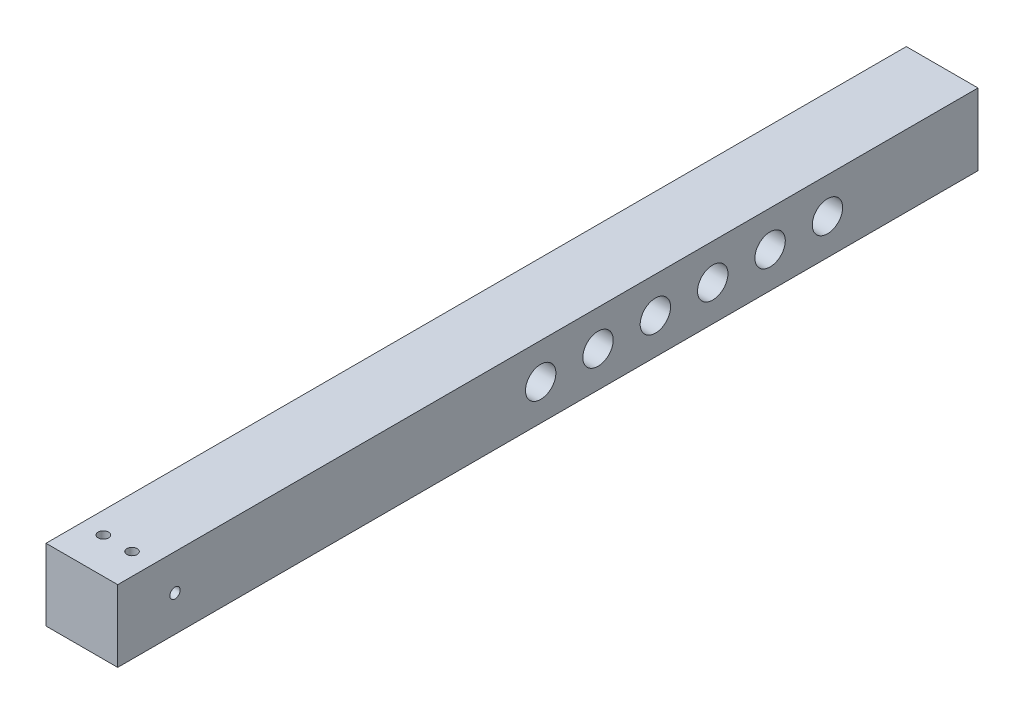
from build123d import *

# Parameters (mm, degrees)
SKETCH1_W               = 25
SKETCH1_H               = 25
BOSS_EXTRUDE1_DEPTH     = 200
SKETCH2_R               = 2.5
CUT_EXTRUDE1_DEPTH      = 202.943680268
SKETCH3_R               = 1.8
CUT_EXTRUDE2_DEPTH      = 202.943680268
SKETCH4_R               = 1.8
CUT_EXTRUDE3_DEPTH      = 202.943680268
CUT_EXTRUDE5_DEPTH      = 202.943680268
CUT_EXTRUDE5_DEPTH_BACK = 202.943680268
SKETCH6_R               = 2.5
CUT_EXTRUDE6_DEPTH      = 202.943680268
CUT_EXTRUDE6_DEPTH_BACK = 202.943680268
SKETCH7_R               = 5.3
CUT_EXTRUDE7_DEPTH      = 202.943680268
CUT_EXTRUDE7_DEPTH_BACK = 202.943680268
SKETCH8_W               = 75
SKETCH8_H               = 25


with BuildPart() as part:
    # Sketch1 → Boss-Extrude1 (new body)
    with BuildSketch(Plane.XY):
        Rectangle(SKETCH1_W, SKETCH1_H)
    boss_extrude1 = extrude(amount=BOSS_EXTRUDE1_DEPTH)

    # Sketch2 → Cut-Extrude1 (cut, through all)
    with BuildSketch(Plane(origin=(12.5, 0, 0), x_dir=(0, 0, -1), z_dir=(1, 0, 0))):
        with Locations((-12.5, 0)):
            Circle(SKETCH2_R)
    cut_extrude1 = extrude(amount=-CUT_EXTRUDE1_DEPTH, mode=Mode.SUBTRACT)

    # Sketch3 → Cut-Extrude2 (cut, through all)
    with BuildSketch(Plane(origin=(0, 12.5, 0), x_dir=(1, 0, 0), z_dir=(0, 1, 0))):
        with Locations((-5, -187.5)):
            Circle(SKETCH3_R)
        with Locations((5, -187.5)):
            Circle(SKETCH3_R)
    cut_extrude2 = extrude(amount=-CUT_EXTRUDE2_DEPTH, mode=Mode.SUBTRACT)

    # Sketch4 → Cut-Extrude3 (cut, symmetric)
    with BuildSketch(Plane.ZY.offset(12.5)):
        with Locations((180, 0)):
            Circle(SKETCH4_R)
    cut_extrude3 = extrude(amount=CUT_EXTRUDE3_DEPTH, both=True, mode=Mode.SUBTRACT)

    # Mirror2: Boss-Extrude1, Cut-Extrude1, Cut-Extrude2, Cut-Extrude3 across plane
    add(boss_extrude1.mirror(Plane(origin=(0, 0, 12.5), x_dir=(1, 0, 0), z_dir=(0, 0, -1))))
    add(cut_extrude1.mirror(Plane(origin=(0, 0, 12.5), x_dir=(1, 0, 0), z_dir=(0, 0, -1))), mode=Mode.SUBTRACT)
    add(cut_extrude2.mirror(Plane(origin=(0, 0, 12.5), x_dir=(1, 0, 0), z_dir=(0, 0, -1))), mode=Mode.SUBTRACT)
    add(cut_extrude3.mirror(Plane(origin=(0, 0, 12.5), x_dir=(1, 0, 0), z_dir=(0, 0, -1))), mode=Mode.SUBTRACT)

    # Sketch6 → Cut-Extrude5 (cut, two sides: drawn at the far end of the back side and taken through both)
    with BuildSketch(Plane(origin=(12.5, 0, 0), x_dir=(0, 0, -1), z_dir=(1, 0, 0)).offset(-CUT_EXTRUDE5_DEPTH_BACK)):
        with Locations((7.5, 0)):
            Circle(SKETCH6_R)
        with Locations((-12.5, 0)):
            Circle(SKETCH6_R)
        with Locations((27.5, 0)):
            Circle(SKETCH6_R)
        with Locations((47.5, 0)):
            Circle(SKETCH6_R)
    extrude(amount=CUT_EXTRUDE5_DEPTH + CUT_EXTRUDE5_DEPTH_BACK, mode=Mode.SUBTRACT)

    # Sketch7 → Cut-Extrude6 (cut, two sides: drawn at the far end of the back side and taken through both)
    with BuildSketch(Plane.ZY.offset(12.5).offset(-CUT_EXTRUDE6_DEPTH_BACK)):
        with Locations((-47.5, 0)):
            Circle(SKETCH7_R)
        with Locations((-27.5, 0)):
            Circle(SKETCH7_R)
        with Locations((-7.5, 0)):
            Circle(SKETCH7_R)
        with Locations((12.5, 0)):
            Circle(SKETCH7_R)
        with Locations((52.5, 0)):
            Circle(SKETCH7_R)
        with Locations((32.5, 0)):
            Circle(SKETCH7_R)
    extrude(amount=CUT_EXTRUDE6_DEPTH + CUT_EXTRUDE6_DEPTH_BACK, mode=Mode.SUBTRACT)

    # Sketch8 → Cut-Extrude7 (cut, two sides: drawn at the far end of the back side and taken through both)
    with BuildSketch(Plane.ZY.offset(12.5).offset(-CUT_EXTRUDE7_DEPTH_BACK)):
        with Locations((-137.5, 0)):
            Rectangle(SKETCH8_W, SKETCH8_H)
    extrude(amount=CUT_EXTRUDE7_DEPTH + CUT_EXTRUDE7_DEPTH_BACK, mode=Mode.SUBTRACT)


solid = part.part
